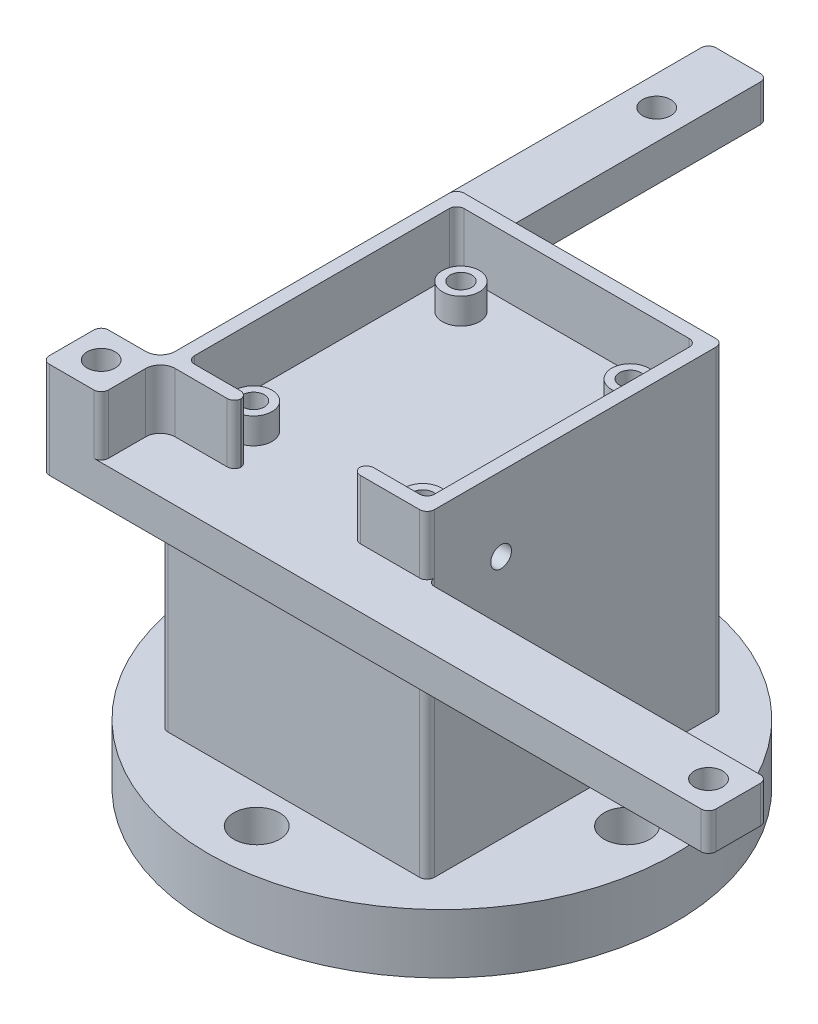
from build123d import *

# Parameters (mm, degrees)
SKETCH1_W           = 36
SKETCH1_H           = 40
BOSS_EXTRUDE1_DEPTH = 5
BOSS_EXTRUDE2_DEPTH = 5
BOSS_EXTRUDE4_DEPTH = 8
FILLET1_R           = 1
FILLET2_R           = 1
FILLET3_R           = 1
SKETCH4_R           = 1.9
CUT_EXTRUDE1_DEPTH  = 91.049986119
SKETCH5_R           = 2.5
BOSS_EXTRUDE5_DEPTH = 3.5
SKETCH6_R           = 1.45
CUT_EXTRUDE2_DEPTH  = 7
SKETCH7_W           = 36
SKETCH7_H           = 40
BOSS_EXTRUDE6_DEPTH = 30
SKETCH8_R           = 31.5
BOSS_EXTRUDE7_DEPTH = 8
SKETCH9_R           = 3.1
CUT_EXTRUDE3_DEPTH  = 8
FILLET5_R           = 1
FILLET6_R           = 1
SKETCH10_R          = 1.4
CUT_EXTRUDE4_DEPTH  = 10


with BuildPart() as part:
    # Sketch1 → Boss-Extrude1 (new body)
    with BuildSketch(Plane(origin=(0, 0, 0), x_dir=(1, 0, 0), z_dir=(0, 1, 0))):
        Rectangle(SKETCH1_W, SKETCH1_H)
    extrude(amount=BOSS_EXTRUDE1_DEPTH)

    # Sketch2 → Boss-Extrude2 (add)
    with BuildSketch(Plane(origin=(0, 5, 0), x_dir=(1, 0, 0), z_dir=(0, 1, 0))):
        Polygon((-18, -20), (-18, 62), (-26, 62), (-26, -28), (64, -28), (64, -20), align=None)
    extrude(amount=-BOSS_EXTRUDE2_DEPTH)

    # Sketch3 → Boss-Extrude4 (add)
    with BuildSketch(Plane(origin=(0, 5, 0), x_dir=(1, 0, 0), z_dir=(0, 1, 0))):
        with BuildLine():
            Line((-18, 20), (18, 20))
            Line((18, 20), (18, -20))
            Line((18, -20), (8, -20))
            Line((8, -20), (8, -18.2))
            Line((8, -18.2), (16.2, -18.2))
            Line((16.2, -18.2), (16.2, 18.2))
            Line((16.2, 18.2), (-16.2, 18.2))
            Line((-16.2, 18.2), (-16.2, -18.2))
            Line((-16.2, -18.2), (-8, -18.2))
            Line((-8, -18.2), (-8, -20))
            Line((-8, -20), (-16, -20))
            ThreePointArc((-16, -20), (-17.414213562, -20.585786438), (-18, -22))
            Line((-18, -22), (-18, -28))
            Line((-18, -28), (-26, -28))
            Line((-26, -28), (-26, -20))
            Line((-26, -20), (-20, -20))
            ThreePointArc((-20, -20), (-18.585786438, -19.414213562), (-18, -18))
            Line((-18, -18), (-18, 20))
        make_face()
    extrude(amount=BOSS_EXTRUDE4_DEPTH)

    # Fillet1
    # the kernel refuses this fillet: 1 mm, written as the material it adds along each edge
    with BuildSketch(Plane(origin=(16.2, 2.5, 18.2), x_dir=(0, 0, -1), z_dir=(0, 1, 0)), Plane(origin=(16.2, 2.5, -18.2), x_dir=(-1, 0, 0), z_dir=(0, 1, 0)), Plane(origin=(-16.2, 2.5, -18.2), x_dir=(0, 0, 1), z_dir=(0, 1, 0)), Plane(origin=(-16.2, 2.5, 18.2), x_dir=(1, 0, 0), z_dir=(0, 1, 0))) as fillet1_piece_1:
        with BuildLine():
            CenterArc((FILLET1_R, FILLET1_R), FILLET1_R, 180, 90)
            Line((0, FILLET1_R), (0, 0))
            Line((0, 0), (FILLET1_R, 0))
        make_face()
    extrude(amount=10.5)
    # the kernel refuses this fillet: 1 mm, written as the material it takes off along each edge
    with BuildSketch(Plane(origin=(-26, 15.5, 28), x_dir=(1, 0, 0), z_dir=(0, -1, 0))) as fillet1_2_piece_1:
        with BuildLine():
            CenterArc((FILLET1_R, -FILLET1_R), FILLET1_R, 90, 90)
            Line((0, -FILLET1_R), (0, 0))
            Line((0, 0), (FILLET1_R, 0))
        make_face()
    extrude(amount=18, mode=Mode.SUBTRACT)
    with BuildSketch(Plane(origin=(-26, 5, 20), x_dir=(0, 0, 1), z_dir=(0, 1, 0)), Plane(origin=(-18, 5, 28), x_dir=(0, 0, -1), z_dir=(0, 1, 0)), Plane(origin=(8, 5, 20), x_dir=(1, 0, 0), z_dir=(0, 1, 0)), Plane(origin=(8, 5, 18.2), x_dir=(0, 0, 1), z_dir=(0, 1, 0)), Plane(origin=(-8, 5, 18.2), x_dir=(-1, 0, 0), z_dir=(0, 1, 0)), Plane(origin=(-8, 5, 20), x_dir=(0, 0, -1), z_dir=(0, 1, 0))) as fillet1_2_piece_2:
        with BuildLine():
            CenterArc((FILLET1_R, FILLET1_R), FILLET1_R, 180, 90)
            Line((0, FILLET1_R), (0, 0))
            Line((0, 0), (FILLET1_R, 0))
        make_face()
    extrude(amount=10.5, mode=Mode.SUBTRACT)

    # Fillet2
    fillet2_edges = [part.edges().sort_by_distance(p)[0] for p in [
        (-18, 9, -20),
        (18, 9, 20),
    ]]
    fillet(fillet2_edges, radius=FILLET2_R)

    # Fillet3
    fillet3_edges = [part.edges().sort_by_distance(p)[0] for p in [
        (-18, 2.5, -62),
        (64, 2.5, 20),
        (64, 2.5, 28),
        (-26, 2.5, -62),
    ]]
    fillet(fillet3_edges, radius=FILLET3_R)

    # Sketch4 → Cut-Extrude1 (cut, through all)
    with BuildSketch(Plane(origin=(0, 13, 0), x_dir=(1, 0, 0), z_dir=(0, 1, 0))):
        with Locations(Location((-22, -24, 0), (0, 0, 270))):
            Circle(SKETCH4_R)
        with Locations(Location((-22, 51, 0), (0, 0, 270))):
            Circle(SKETCH4_R)
        with Locations(Location((60, -24, 0), (0, 0, 270))):
            Circle(SKETCH4_R)
    extrude(amount=-CUT_EXTRUDE1_DEPTH, mode=Mode.SUBTRACT)

    # Sketch5 → Boss-Extrude5 (add)
    with BuildSketch(Plane(origin=(0, 5, 0), x_dir=(1, 0, 0), z_dir=(0, 1, 0))):
        with Locations(Location((-11.425, 14, 0), (0, 0, 270))):
            Circle(SKETCH5_R)
        with Locations(Location((11.425, 14, 0), (0, 0, 270))):
            Circle(SKETCH5_R)
        with Locations(Location((11.425, -14, 0), (0, 0, 270))):
            Circle(SKETCH5_R)
        with Locations(Location((-11.425, -14, 0), (0, 0, 270))):
            Circle(SKETCH5_R)
    extrude(amount=BOSS_EXTRUDE5_DEPTH)

    # Sketch6 → Cut-Extrude2 (cut)
    with BuildSketch(Plane(origin=(0, 8.5, 0), x_dir=(1, 0, 0), z_dir=(0, 1, 0))):
        with Locations(Location((-11.425, 14, 0), (0, 0, 270))):
            Circle(SKETCH6_R)
        with Locations(Location((11.425, 14, 0), (0, 0, 270))):
            Circle(SKETCH6_R)
        with Locations(Location((11.425, -14, 0), (0, 0, 270))):
            Circle(SKETCH6_R)
        with Locations(Location((-11.425, -14, 0), (0, 0, 270))):
            Circle(SKETCH6_R)
    extrude(amount=-CUT_EXTRUDE2_DEPTH, mode=Mode.SUBTRACT)

    # Sketch7 → Boss-Extrude6 (add)
    with BuildSketch(Plane.XZ):
        Rectangle(SKETCH7_W, SKETCH7_H)
    extrude(amount=BOSS_EXTRUDE6_DEPTH)

    # Sketch8 → Boss-Extrude7 (add)
    with BuildSketch(Plane.XZ.offset(30)):
        with Locations(Location((0, 0, 0), (0, 0, 270))):
            Circle(SKETCH8_R)
    extrude(amount=BOSS_EXTRUDE7_DEPTH)

    # Sketch9 → Cut-Extrude3 (cut)
    with BuildSketch(Plane.XZ.offset(38)):
        with Locations(Location((0, 25, 0), (0, 0, 270))):
            Circle(SKETCH9_R)
        with Locations(Location((-25, 0, 0), (0, 0, 270))):
            Circle(SKETCH9_R)
        with Locations(Location((25, 0, 0), (0, 0, 270))):
            Circle(SKETCH9_R)
        with Locations(Location((0, -25, 0), (0, 0, 270))):
            Circle(SKETCH9_R)
    extrude(amount=-CUT_EXTRUDE3_DEPTH, mode=Mode.SUBTRACT)

    # Fillet5
    fillet5_edges = [part.edges().sort_by_distance(p)[0] for p in [
        (-18, -15, 20),
        (-18, -15, -20),
        (18, -15, 20),
        (18, -8.5, -20),
    ]]
    fillet(fillet5_edges, radius=FILLET5_R)

    # Fillet6
    fillet6_edges = [part.edges().sort_by_distance(p)[0] for p in [
        (-18, 2.5, -20),
        (18, 2.5, 20),
    ]]
    fillet(fillet6_edges, radius=FILLET6_R)

    # Sketch10 → Cut-Extrude4 (cut)
    with BuildSketch(Plane(origin=(18, 0, 0), x_dir=(0, 0, -1), z_dir=(1, 0, 0))):
        with Locations((-10, -12)):
            Circle(SKETCH10_R)
        with Locations((-10, 3)):
            Circle(SKETCH10_R)
    extrude(amount=-CUT_EXTRUDE4_DEPTH, mode=Mode.SUBTRACT)


solid = part.part
